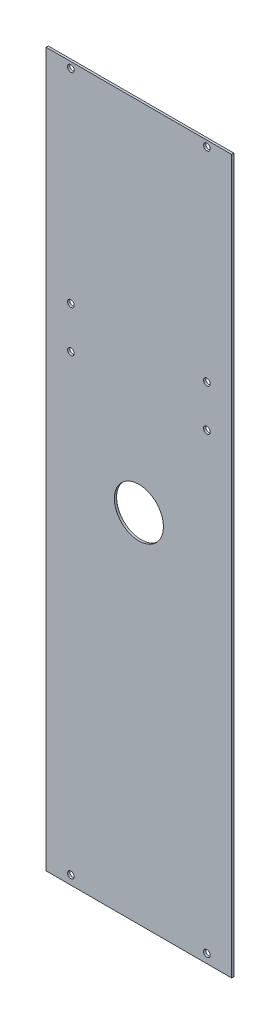
from build123d import *

# Parameters (mm, degrees)
SKETCH1_W                = 83.2
SKETCH1_H                = 320
BOSS_EXTRUDE1_DEPTH      = 1
F_3_0_3_DIAMETER_HOLE1_D = 3
SKETCH_1_R               = 11
CUT_EXTRUDE_1_DEPTH      = 166.322593737


with BuildPart() as part:
    # Sketch1 → Boss-Extrude1 (new body)
    with BuildSketch(Plane.XY):
        Rectangle(SKETCH1_W, SKETCH1_H)
    extrude(amount=BOSS_EXTRUDE1_DEPTH)

    # Ø3.0 (3) Diameter Hole1 (through all)
    with Locations(Plane.XY.offset(1)):
        with Locations((-30.5, 66), (30.5, 66), (30.5, -156), (-30.5, -156), (-30.5, 157.3), (30.5, 157.3), (-30.5, 47.3), (30.5, 47.3)):
            Hole(F_3_0_3_DIAMETER_HOLE1_D / 2)

    # Эскиз1 → Вырез-Вытянуть1 (cut, through all)
    with BuildSketch(Plane.XY.offset(1)):
        Circle(SKETCH_1_R)
    extrude(amount=-CUT_EXTRUDE_1_DEPTH, mode=Mode.SUBTRACT)


solid = part.part
